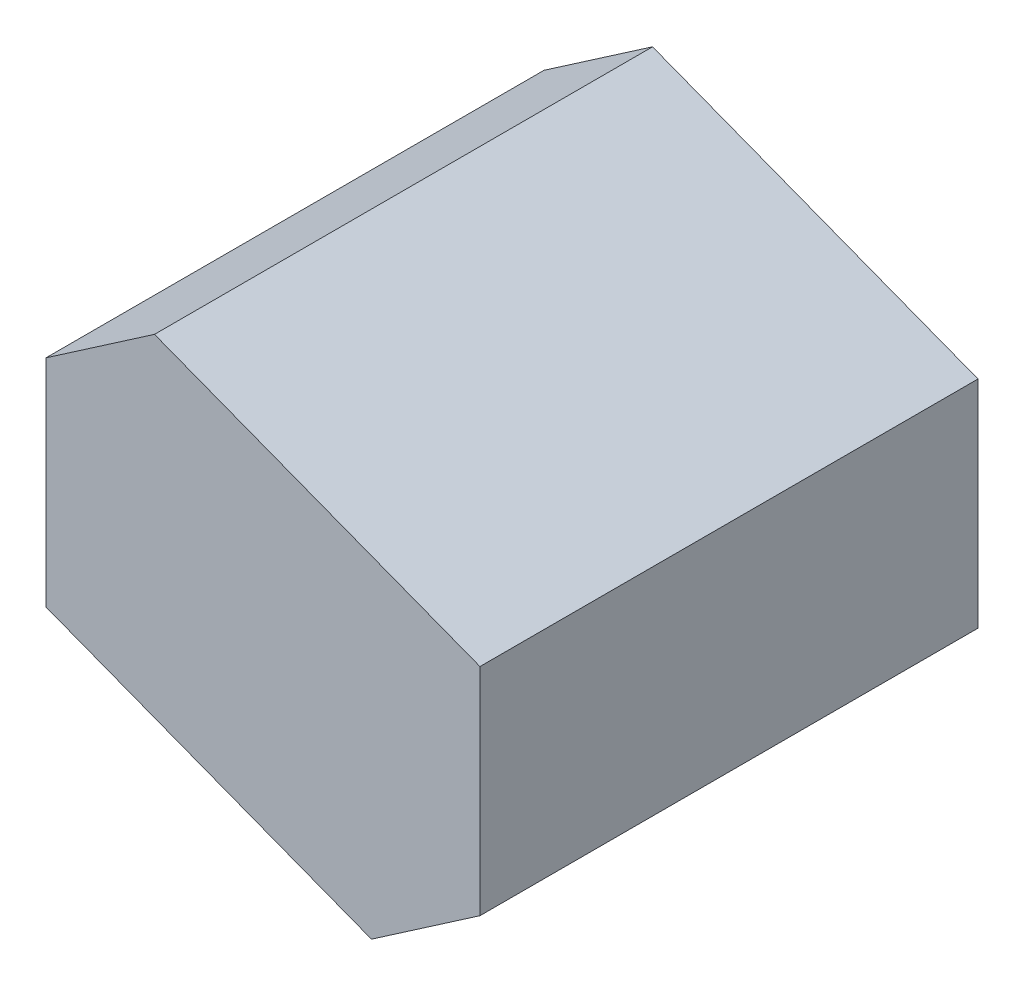
from build123d import *

# Parameters (mm, degrees)
BOSS_EXTRUDE1_DEPTH = 38.1
CUT_EXTRUDE1_DEPTH  = 98.457965419
SHELL1_START        = -38.1
SHELL1_DEPTH        = 75.35333418
FILLET1_R           = 17.78


# Read off the part's stored shape, not the designer's step: Shell1
with BuildPart() as part:
    # Sketch1 → Boss-Extrude1 (new, symmetric)
    with BuildSketch(Plane.XY):
        Polygon((-33.198119966, 25.4), (-33.198119966, -25.4), (33.198119966, -50.887128572), (33.198119966, -0.087128572), align=None)
    extrude(amount=BOSS_EXTRUDE1_DEPTH, both=True)

    # Sketch2 → Cut-Extrude1 (cut, through all)
    with BuildSketch(Plane.XY.offset(38.1)):
        Polygon((16.599059983, -44.515346429), (33.198119966, -33.107128572), (33.198119966, -50.887128572), align=None)
        Polygon((-16.599059983, 19.028217857), (-33.198119966, 25.4), (-33.198119966, 7.62), align=None)
    extrude(amount=-CUT_EXTRUDE1_DEPTH, mode=Mode.SUBTRACT)

    # Shell1 outline → Shell1 (cut)
    with BuildSketch(Plane.XY.offset(SHELL1_START)):
        Polygon((31.928119966, -0.506523102), (-16.486612201, 18.078151343), (-32.351454146, 7.174547563), (-32.351454146, -24.818102704), (16.486612201, -43.565279915), (31.928119966, -32.952625656), align=None)
    extrude(amount=SHELL1_DEPTH, mode=Mode.SUBTRACT)

    # Fillet1
    # the kernel refuses this fillet: 17.78 mm, written as the material it adds along each edge
    with BuildSketch(Plane(origin=(-14.571454146, -2.179962965, 19.47333418), x_dir=(-0.5664062369240325, 0.8241261886225658, 0), z_dir=(0, 0, 1))) as fillet1_piece_1_section:
        Polygon((0, 0), (FILLET1_R * 1.02, 0), (FILLET1_R * 1.02, FILLET1_R * 0.536647960523), (FILLET1_R * 0.577734361663, FILLET1_R * 0.840608712395), align=None)
    fillet1_piece_1 = extrude(amount=FILLET1_R * 1.02, mode=Mode.PRIVATE)
    fillet1_piece_1 = fillet1_piece_1 - Plane(origin=(-14.571454146, -2.179962965, 19.47333418), x_dir=(0.8849876374628157, -0.4656145203255411, 0), z_dir=(0, 0, 1)) * Sphere(FILLET1_R, mode=Mode.PRIVATE)
    add(fillet1_piece_1)
    with BuildSketch(Plane(origin=(-14.571454146, -12.59824726, 19.47333418), x_dir=(-1, 0, 0), z_dir=(0, 0, 1))) as fillet1_piece_2_section:
        Polygon((0, 0), (FILLET1_R * 1.02, 0), (FILLET1_R * 1.02, FILLET1_R * 0.701026577777), (FILLET1_R * 0.365535308531, FILLET1_R * 0.952252035029), align=None)
    fillet1_piece_2 = extrude(amount=FILLET1_R * 1.02, mode=Mode.PRIVATE)
    fillet1_piece_2 = fillet1_piece_2 - Plane(origin=(-14.571454146, -12.59824726, 19.47333418), x_dir=(0.8241261886205663, 0.5664062369269417, 0), z_dir=(0, 0, 1)) * Sphere(FILLET1_R, mode=Mode.PRIVATE)
    add(fillet1_piece_2)
    with BuildSketch(Plane(origin=(14.148119966, -12.726378546, 19.47333418), x_dir=(0.35836794954893786, 0.9335804264958054, 0), z_dir=(0, 0, 1))) as fillet1_piece_3_section:
        Polygon((0, 0), (FILLET1_R * 1.02, 0), (FILLET1_R * 1.02, -FILLET1_R * 0.701026577771), (FILLET1_R * 0.36553530854, -FILLET1_R * 0.952252035026), align=None)
    fillet1_piece_3 = extrude(amount=FILLET1_R * 1.02, mode=Mode.PRIVATE)
    fillet1_piece_3 = fillet1_piece_3 - Plane(origin=(14.148119966, -12.726378546, 19.47333418), x_dir=(-0.824126188623119, -0.5664062369232272, 0), z_dir=(0, 0, 1)) * Sphere(FILLET1_R, mode=Mode.PRIVATE)
    add(fillet1_piece_3)
    with BuildSketch(Plane(origin=(-14.125206416, -1.873265397, 19.47333418), x_dir=(0.35836794954893786, 0.9335804264958054, 0), z_dir=(0, 0, 1))) as fillet1_piece_4_section:
        Polygon((0, 0), (FILLET1_R * 1.02, 0), (FILLET1_R * 1.02, FILLET1_R * 0.536647960524), (FILLET1_R * 0.577734361661, FILLET1_R * 0.840608712396), align=None)
    fillet1_piece_4 = extrude(amount=FILLET1_R * 1.02, mode=Mode.PRIVATE)
    fillet1_piece_4 = fillet1_piece_4 - Plane(origin=(-14.125206416, -1.873265397, 19.47333418), x_dir=(0.11753739745542074, -0.9930684569552123, 0), z_dir=(0, 0, 1)) * Sphere(FILLET1_R, mode=Mode.PRIVATE)
    add(fillet1_piece_4)
    with BuildSketch(Plane(origin=(-32.351454146, -2.179962965, 37.25333418), x_dir=(0, 0, -1), z_dir=(0, -1, 0))) as fillet1_piece_5:
        with BuildLine():
            CenterArc((FILLET1_R, FILLET1_R), FILLET1_R, 180, 90)
            Line((0, FILLET1_R), (0, 0))
            Line((0, 0), (FILLET1_R, 0))
        make_face()
    extrude(amount=10.418284295)
    with BuildSketch(Plane(origin=(-20.943236289, -29.197307243, 37.25333418), x_dir=(0, 0, -1), z_dir=(0.9335804264990358, -0.3583679495405224, 0))) as fillet1_piece_6_section:
        with BuildLine():
            CenterArc((FILLET1_R, FILLET1_R), FILLET1_R, 180, 90)
            Line((0, FILLET1_R), (0, 0))
            Line((0, 0), (FILLET1_R, 0))
        make_face()
    fillet1_piece_6 = extrude(amount=84.542794822, mode=Mode.PRIVATE)
    fillet1_piece_6 = split(fillet1_piece_6, bisect_by=Plane(origin=(10.612775851, -47.602255792, 33.386694553), z_dir=(-0.5664062369254325, 0.8241261886216036, 0)), keep=Keep.TOP, mode=Mode.PRIVATE)
    fillet1_piece_6 = split(fillet1_piece_6, bisect_by=Plane(origin=(31.928119966, -33.018136408, 33.386694553), z_dir=(-1, 0, 0)), keep=Keep.TOP, mode=Mode.PRIVATE)
    add(fillet1_piece_6)
    with BuildSketch(Plane(origin=(31.928119966, -77.402625656, 37.25333418), x_dir=(0, 0, -1), z_dir=(0, 1, 0))) as fillet1_piece_7_section:
        with BuildLine():
            CenterArc((FILLET1_R, FILLET1_R), FILLET1_R, 180, 90)
            Line((0, FILLET1_R), (0, 0))
            Line((0, 0), (FILLET1_R, 0))
        make_face()
    fillet1_piece_7 = extrude(amount=64.67624711, mode=Mode.PRIVATE)
    fillet1_piece_7 = split(fillet1_piece_7, bisect_by=Plane(origin=(19.754469789, -44.819692915, 33.477432333), z_dir=(0.3583679495405224, 0.9335804264990358, 0)), keep=Keep.TOP, mode=Mode.PRIVATE)
    fillet1_piece_7 = split(fillet1_piece_7, bisect_by=Plane(origin=(33.035848264, -32.191305089, 33.477432333), z_dir=(-0.5664062369254325, 0.8241261886216036, 0)), keep=Keep.TOP, mode=Mode.PRIVATE)
    add(fillet1_piece_7)
    with BuildSketch(Plane(origin=(-32.351454146, -24.818102704, -38.1), x_dir=(0, 1, 0), z_dir=(0, 0, 1))) as fillet1_piece_8:
        with BuildLine():
            CenterArc((FILLET1_R * 0.687280958605, -FILLET1_R), FILLET1_R, 90, 69)
            Line((-FILLET1_R * 0.246299467894, -FILLET1_R * 0.641632050459), (0, 0))
            Line((0, 0), (FILLET1_R * 0.687280958605, 0))
        make_face()
    extrude(amount=57.57333418)
    with BuildSketch(Plane(origin=(-32.351454146, 7.174547563, -38.1), x_dir=(0.8241261886225659, 0.5664062369240322, 0), z_dir=(0, 0, 1))) as fillet1_piece_9:
        with BuildLine():
            CenterArc((FILLET1_R * 0.526125451493, -FILLET1_R), FILLET1_R, 90, 55.5)
            Line((-FILLET1_R * 0.29800073713, -FILLET1_R * 0.433593763076), (0, 0))
            Line((0, 0), (FILLET1_R * 0.526125451493, 0))
        make_face()
    extrude(amount=57.57333418)
    with BuildSketch(Plane(origin=(16.486612201, -43.565279915, -38.1), x_dir=(-0.933580426499036, 0.3583679495405219, 0), z_dir=(0, 0, 1))) as fillet1_piece_10:
        with BuildLine():
            CenterArc((FILLET1_R * 0.526125451489, -FILLET1_R), FILLET1_R, 90, 55.5)
            Line((-FILLET1_R * 0.29800073713, -FILLET1_R * 0.433593763072), (0, 0))
            Line((0, 0), (FILLET1_R * 0.526125451489, 0))
        make_face()
    extrude(amount=75.35333418)
    with BuildSketch(Plane(origin=(31.928119966, -32.952625656, -38.1), x_dir=(-0.8241261886216035, -0.5664062369254323, 0), z_dir=(0, 0, 1))) as fillet1_piece_11:
        with BuildLine():
            CenterArc((FILLET1_R * 0.526125451492, -FILLET1_R), FILLET1_R, 90, 55.5)
            Line((-FILLET1_R * 0.29800073713, -FILLET1_R * 0.433593763075), (0, 0))
            Line((0, 0), (FILLET1_R * 0.526125451492, 0))
        make_face()
    extrude(amount=75.35333418)
    with BuildSketch(Plane(origin=(-16.486612201, 18.078151343, -38.1), x_dir=(0.9335804264958054, -0.35836794954893825, 0), z_dir=(0, 0, 1))) as fillet1_piece_12:
        with BuildLine():
            CenterArc((FILLET1_R * 0.526125451494, -FILLET1_R), FILLET1_R, 90, 55.5)
            Line((-FILLET1_R * 0.29800073713, -FILLET1_R * 0.433593763078), (0, 0))
            Line((0, 0), (FILLET1_R * 0.526125451494, 0))
        make_face()
    extrude(amount=57.57333418)
    with BuildSketch(Plane(origin=(31.928119966, -0.506523102, -38.1), x_dir=(-0.9335804264958055, 0.3583679495489376, 0), z_dir=(0, 0, 1))) as fillet1_piece_13:
        with BuildLine():
            CenterArc((FILLET1_R * 0.687280958599, FILLET1_R), FILLET1_R, 201, 69)
            Line((-FILLET1_R * 0.246299467897, FILLET1_R * 0.641632050451), (0, 0))
            Line((0, 0), (FILLET1_R * 0.687280958599, 0))
        make_face()
    extrude(amount=57.57333418)
    with BuildSketch(Plane(origin=(20.519902109, 3.872681437, 37.25333418), x_dir=(0, 0, -1), z_dir=(-0.9335804264958054, 0.35836794954893786, 0))) as fillet1_piece_14:
        with BuildLine():
            CenterArc((FILLET1_R, FILLET1_R), FILLET1_R, 180, 90)
            Line((0, FILLET1_R), (0, 0))
            Line((0, 0), (FILLET1_R, 0))
        make_face()
    extrude(amount=30.284832008)
    with BuildSketch(Plane(origin=(-24.195909309, 12.779698237, 37.25333418), x_dir=(0, 0, -1), z_dir=(-0.8241261886225658, -0.5664062369240325, 0))) as fillet1_piece_15:
        with BuildLine():
            CenterArc((FILLET1_R, FILLET1_R), FILLET1_R, 180, 90)
            Line((0, FILLET1_R), (0, 0))
            Line((0, 0), (FILLET1_R, 0))
        make_face()
    extrude(amount=0.541479856)


solid = part.part
